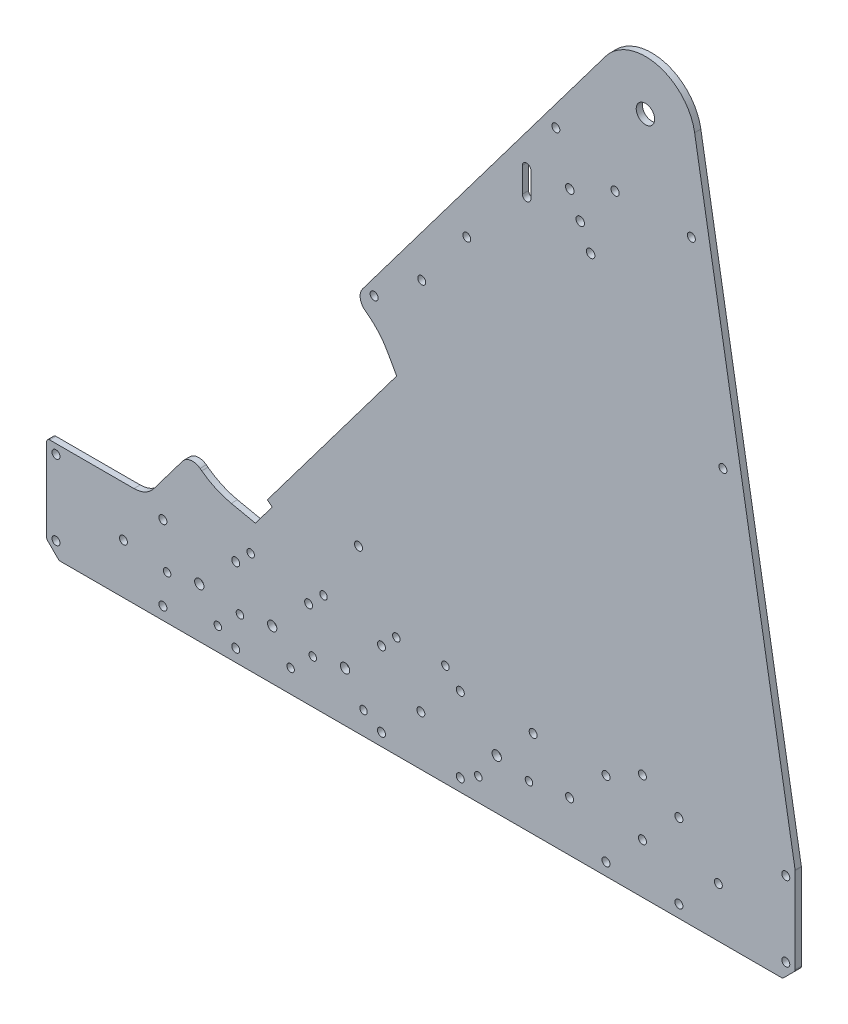
from build123d import *

# Parameters (mm, degrees)
BOSS_EXTRUDE1_DEPTH = 3.175
CUT_EXTRUDE1_REACH  = 534.132
SKETCH2_R           = 2.032
SKETCH5_R           = 2.032
SKETCH5_R_2         = 2.38125
CUT_EXTRUDE4_DEPTH  = 533.132273265
SKETCH6_R           = 2.032
CUT_EXTRUDE5_DEPTH  = 533.132273265
SKETCH3_R           = 4.699
SKETCH3_R_2         = 2.032
SKETCH3_R_3         = 2.0955
SKETCH3_R_4         = 2.159
CUT_EXTRUDE2_DEPTH  = 533.132273265
FILLET1_R           = 1.5875
CUT_EXTRUDE3_REACH  = 534.132
SKETCH4_R           = 1.905
FILLET2_R           = 38.1
FILLET3_R           = 6.35


with BuildPart() as part:
    # Sketch1 → Boss-Extrude1 (new body)
    with BuildSketch(Plane.XY):
        with BuildLine():
            Line((0, 0), (381, 0))
            Line((381, 0), (381, 50.8))
            Line((381, 50.8), (329.837432577, 350.351326687))
            ThreePointArc((329.837432577, 350.351326687), (310.787920632, 370.759100277), (284.504927721, 361.348180455))
            Line((284.504927721, 361.348180455), (157.027492501, 191.955579526))
            Line((157.027492501, 191.955579526), (169.711912675, 182.409841741))
            Line((169.711912675, 182.409841741), (178.167615548, 167.244965001))
            Line((178.167615548, 167.244965001), (112.326505112, 79.754995301))
            Line((112.326505112, 79.754995301), (114.863389147, 77.845847744))
            Line((114.863389147, 77.845847744), (106.272225141, 66.429869588))
            Line((106.272225141, 66.429869588), (85.709420174, 70.786944209))
            Line((85.709420174, 70.786944209), (73.025, 80.332681993))
            Line((73.025, 80.332681993), (54.610499914, 55.863409773))
            ThreePointArc((54.610499914, 55.863409773), (50.133294634, 52.136138511), (44.462963775, 50.8))
            Line((44.462963775, 50.8), (0, 50.8))
            Line((0, 50.8), (0, 0))
        make_face()
    extrude(amount=BOSS_EXTRUDE1_DEPTH)

    # Sketch2 → Cut-Extrude1 (cut, up to next)
    with BuildSketch(Plane.XY.offset(3.175), mode=Mode.PRIVATE) as cut_extrude1_sk1:
        with Locations((4.7625, 46.0375)):
            Circle(SKETCH2_R)
    cut_extrude1_tool1 = extrude(cut_extrude1_sk1.sketch, amount=-CUT_EXTRUDE1_REACH, mode=Mode.PRIVATE) & part.part
    # Sketch2 → Cut-Extrude1 (cut, up to next)
    with BuildSketch(Plane.XY.offset(3.175), mode=Mode.PRIVATE) as cut_extrude1_sk2:
        with Locations((4.7625, 7.9375)):
            Circle(SKETCH2_R)
    cut_extrude1_tool2 = extrude(cut_extrude1_sk2.sketch, amount=-CUT_EXTRUDE1_REACH, mode=Mode.PRIVATE) & part.part
    # Sketch2 → Cut-Extrude1 (cut, up to next)
    with BuildSketch(Plane.XY.offset(3.175), mode=Mode.PRIVATE) as cut_extrude1_sk3:
        with Locations((376.2375, 7.9375)):
            Circle(SKETCH2_R)
    cut_extrude1_tool3 = extrude(cut_extrude1_sk3.sketch, amount=-CUT_EXTRUDE1_REACH, mode=Mode.PRIVATE) & part.part
    # Sketch2 → Cut-Extrude1 (cut, up to next)
    with BuildSketch(Plane.XY.offset(3.175), mode=Mode.PRIVATE) as cut_extrude1_sk4:
        with Locations((376.2375, 46.0375)):
            Circle(SKETCH2_R)
    cut_extrude1_tool4 = extrude(cut_extrude1_sk4.sketch, amount=-CUT_EXTRUDE1_REACH, mode=Mode.PRIVATE) & part.part
    # Sketch2 → Cut-Extrude1 (cut, up to next)
    with BuildSketch(Plane.XY.offset(3.175), mode=Mode.PRIVATE) as cut_extrude1_sk5:
        Polygon((0, 6.35), (0, 0), (6.35, 0), align=None)
    cut_extrude1_tool5 = extrude(cut_extrude1_sk5.sketch, amount=-CUT_EXTRUDE1_REACH, mode=Mode.PRIVATE) & part.part
    # Sketch2 → Cut-Extrude1 (cut, up to next)
    with BuildSketch(Plane.XY.offset(3.175), mode=Mode.PRIVATE) as cut_extrude1_sk6:
        Polygon((381, 0), (374.65, 0), (381, 6.35), align=None)
    cut_extrude1_tool6 = extrude(cut_extrude1_sk6.sketch, amount=-CUT_EXTRUDE1_REACH, mode=Mode.PRIVATE) & part.part
    add(cut_extrude1_tool1.solids().sort_by_distance((4.7625, 46.0375, 3.175))[0], mode=Mode.SUBTRACT)
    add(cut_extrude1_tool2.solids().sort_by_distance((4.7625, 7.9375, 3.175))[0], mode=Mode.SUBTRACT)
    add(cut_extrude1_tool3.solids().sort_by_distance((376.2375, 7.9375, 3.175))[0], mode=Mode.SUBTRACT)
    add(cut_extrude1_tool4.solids().sort_by_distance((376.2375, 46.0375, 3.175))[0], mode=Mode.SUBTRACT)
    add(cut_extrude1_tool5.solids().sort_by_distance((2.116667, 2.116667, 3.175))[0], mode=Mode.SUBTRACT)
    add(cut_extrude1_tool6.solids().sort_by_distance((378.883333, 2.116667, 3.175))[0], mode=Mode.SUBTRACT)

    # Sketch5 → Cut-Extrude4 (cut, through all)
    with BuildSketch(Plane.XY.offset(3.175)):
        with Locations((39.116, 25.4)):
            Circle(SKETCH5_R)
        with Locations((59.182, 6.35)):
            Circle(SKETCH5_R)
        with Locations((59.182, 44.45)):
            Circle(SKETCH5_R)
        with Locations((96.266, 44.45)):
            Circle(SKETCH5_R)
        with Locations((133.35, 44.45)):
            Circle(SKETCH5_R)
        with Locations((170.434, 44.45)):
            Circle(SKETCH5_R)
        with Locations((210.566, 44.45)):
            Circle(SKETCH5_R)
        with Locations((210.566, 6.35)):
            Circle(SKETCH5_R)
        with Locations((170.434, 6.35)):
            Circle(SKETCH5_R)
        with Locations((247.65, 44.45)):
            Circle(SKETCH5_R)
        with Locations((266.192, 25.4)):
            Circle(SKETCH5_R)
        with Locations((77.724, 25.4)):
            Circle(SKETCH5_R_2)
        with Locations((114.808, 25.4)):
            Circle(SKETCH5_R_2)
        with Locations((151.892, 25.4)):
            Circle(SKETCH5_R_2)
        with Locations((229.108, 25.4)):
            Circle(SKETCH5_R_2)
        with Locations((190.5, 25.4)):
            Circle(SKETCH5_R)
        with Locations((303.276, 25.4)):
            Circle(SKETCH5_R)
        with Locations((341.884, 25.4)):
            Circle(SKETCH5_R)
    extrude(amount=-CUT_EXTRUDE4_DEPTH, mode=Mode.SUBTRACT)

    # Sketch6 → Cut-Extrude5 (cut, through all)
    with BuildSketch(Plane.XY.offset(3.175)):
        with Locations((284.734, 44.45)):
            Circle(SKETCH6_R)
        with Locations((284.734, 6.35)):
            Circle(SKETCH6_R)
        with Locations((321.818, 6.35)):
            Circle(SKETCH6_R)
        with Locations((321.818, 44.45)):
            Circle(SKETCH6_R)
        with Locations((96.266, 6.35)):
            Circle(SKETCH6_R)
        with Locations((303.276, 53.975)):
            Circle(SKETCH6_R)
    extrude(amount=-CUT_EXTRUDE5_DEPTH, mode=Mode.SUBTRACT)

    # Sketch3 → Cut-Extrude2 (cut, through all)
    with BuildSketch(Plane.XY.offset(3.175)):
        with Locations((304.8, 346.075)):
            Circle(SKETCH3_R)
        with Locations((166.6875, 196.85)):
            Circle(SKETCH3_R_2)
        with Locations((158.75, 82.55)):
            Circle(SKETCH3_R_2)
        with Locations((289.373209699, 304.387871998)):
            Circle(SKETCH3_R_3)
        with Locations((266.295701738, 293.777093219)):
            Circle(SKETCH3_R_4)
        with Locations((271.601091128, 282.238339238)):
            Circle(SKETCH3_R_4)
        with Locations((276.906480518, 270.699585258)):
            Circle(SKETCH3_R_4)
        with Locations((328.186766793, 303.440372165)):
            Circle(SKETCH3_R_2)
        with Locations((344.222991868, 209.55)):
            Circle(SKETCH3_R_2)
        with Locations((259.211844923, 317.178274551)):
            Circle(SKETCH3_R_2)
        with Locations((213.851281588, 246.342608418)):
            Circle(SKETCH3_R_2)
        with Locations((190.941510906, 215.9)):
            Circle(SKETCH3_R_2)
        with BuildLine():
            Line((242.153661094, 279.4), (242.153661094, 292.1))
            ThreePointArc((242.153661094, 292.1), (244.312661094, 294.259), (246.471661094, 292.1))
            Line((246.471661094, 292.1), (246.471661094, 279.4))
            ThreePointArc((246.471661094, 279.4), (244.312661094, 277.241), (242.153661094, 279.4))
        make_face()
    extrude(amount=-CUT_EXTRUDE2_DEPTH, mode=Mode.SUBTRACT)

    # Fillet1
    fillet1_edges = [part.edges().sort_by_distance(p)[0] for p in [
        (374.65, 0, 1.5875),
        (381, 6.35, 1.5875),
        (381, 50.8, 1.5875),
        (6.35, 0, 1.5875),
        (0, 6.35, 1.5875),
        (0, 50.8, 1.5875),
    ]]
    fillet(fillet1_edges, radius=FILLET1_R)

    # Sketch4 → Cut-Extrude3 (cut, up to next)
    with BuildSketch(Plane(origin=(0, 0, 0), x_dir=(-1, 0, 0), z_dir=(0, 0, -1)), mode=Mode.PRIVATE) as cut_extrude3_sk1:
        with Locations((-61.318145625, 22.298133105)):
            Circle(SKETCH4_R)
    cut_extrude3_tool1 = extrude(cut_extrude3_sk1.sketch, amount=-CUT_EXTRUDE3_REACH, mode=Mode.PRIVATE) & part.part
    # Sketch4 → Cut-Extrude3 (cut, up to next)
    with BuildSketch(Plane(origin=(0, 0, 0), x_dir=(-1, 0, 0), z_dir=(0, 0, -1)), mode=Mode.PRIVATE) as cut_extrude3_sk2:
        with Locations((-87.131339764, 11.605958005)):
            Circle(SKETCH4_R)
    cut_extrude3_tool2 = extrude(cut_extrude3_sk2.sketch, amount=-CUT_EXTRUDE3_REACH, mode=Mode.PRIVATE) & part.part
    # Sketch4 → Cut-Extrude3 (cut, up to next)
    with BuildSketch(Plane(origin=(0, 0, 0), x_dir=(-1, 0, 0), z_dir=(0, 0, -1)), mode=Mode.PRIVATE) as cut_extrude3_sk3:
        with Locations((-98.402145625, 22.298133105)):
            Circle(SKETCH4_R)
    cut_extrude3_tool3 = extrude(cut_extrude3_sk3.sketch, amount=-CUT_EXTRUDE3_REACH, mode=Mode.PRIVATE) & part.part
    # Sketch4 → Cut-Extrude3 (cut, up to next)
    with BuildSketch(Plane(origin=(0, 0, 0), x_dir=(-1, 0, 0), z_dir=(0, 0, -1)), mode=Mode.PRIVATE) as cut_extrude3_sk4:
        with Locations((-124.215339764, 11.605958005)):
            Circle(SKETCH4_R)
    cut_extrude3_tool4 = extrude(cut_extrude3_sk4.sketch, amount=-CUT_EXTRUDE3_REACH, mode=Mode.PRIVATE) & part.part
    # Sketch4 → Cut-Extrude3 (cut, up to next)
    with BuildSketch(Plane(origin=(0, 0, 0), x_dir=(-1, 0, 0), z_dir=(0, 0, -1)), mode=Mode.PRIVATE) as cut_extrude3_sk5:
        with Locations((-135.486145625, 22.298133105)):
            Circle(SKETCH4_R)
    cut_extrude3_tool5 = extrude(cut_extrude3_sk5.sketch, amount=-CUT_EXTRUDE3_REACH, mode=Mode.PRIVATE) & part.part
    # Sketch4 → Cut-Extrude3 (cut, up to next)
    with BuildSketch(Plane(origin=(0, 0, 0), x_dir=(-1, 0, 0), z_dir=(0, 0, -1)), mode=Mode.PRIVATE) as cut_extrude3_sk6:
        with Locations((-161.299339764, 11.605958005)):
            Circle(SKETCH4_R)
    cut_extrude3_tool6 = extrude(cut_extrude3_sk6.sketch, amount=-CUT_EXTRUDE3_REACH, mode=Mode.PRIVATE) & part.part
    # Sketch4 → Cut-Extrude3 (cut, up to next)
    with BuildSketch(Plane(origin=(0, 0, 0), x_dir=(-1, 0, 0), z_dir=(0, 0, -1)), mode=Mode.PRIVATE) as cut_extrude3_sk7:
        with Locations((-245.513854375, 22.298133105)):
            Circle(SKETCH4_R)
    cut_extrude3_tool7 = extrude(cut_extrude3_sk7.sketch, amount=-CUT_EXTRUDE3_REACH, mode=Mode.PRIVATE) & part.part
    # Sketch4 → Cut-Extrude3 (cut, up to next)
    with BuildSketch(Plane(origin=(0, 0, 0), x_dir=(-1, 0, 0), z_dir=(0, 0, -1)), mode=Mode.PRIVATE) as cut_extrude3_sk8:
        with Locations((-219.700660236, 11.605958005)):
            Circle(SKETCH4_R)
    cut_extrude3_tool8 = extrude(cut_extrude3_sk8.sketch, amount=-CUT_EXTRUDE3_REACH, mode=Mode.PRIVATE) & part.part
    # Sketch4 → Cut-Extrude3 (cut, up to next)
    with BuildSketch(Plane(origin=(0, 0, 0), x_dir=(-1, 0, 0), z_dir=(0, 0, -1)), mode=Mode.PRIVATE) as cut_extrude3_sk9:
        with Locations((-202.981986443, 51.968407021)):
            Circle(SKETCH4_R)
    cut_extrude3_tool9 = extrude(cut_extrude3_sk9.sketch, amount=-CUT_EXTRUDE3_REACH, mode=Mode.PRIVATE) & part.part
    # Sketch4 → Cut-Extrude3 (cut, up to next)
    with BuildSketch(Plane(origin=(0, 0, 0), x_dir=(-1, 0, 0), z_dir=(0, 0, -1)), mode=Mode.PRIVATE) as cut_extrude3_sk10:
        with Locations((-178.018013557, 51.968407021)):
            Circle(SKETCH4_R)
    cut_extrude3_tool10 = extrude(cut_extrude3_sk10.sketch, amount=-CUT_EXTRUDE3_REACH, mode=Mode.PRIVATE) & part.part
    # Sketch4 → Cut-Extrude3 (cut, up to next)
    with BuildSketch(Plane(origin=(0, 0, 0), x_dir=(-1, 0, 0), z_dir=(0, 0, -1)), mode=Mode.PRIVATE) as cut_extrude3_sk11:
        with Locations((-140.934013557, 51.968407021)):
            Circle(SKETCH4_R)
    cut_extrude3_tool11 = extrude(cut_extrude3_sk11.sketch, amount=-CUT_EXTRUDE3_REACH, mode=Mode.PRIVATE) & part.part
    # Sketch4 → Cut-Extrude3 (cut, up to next)
    with BuildSketch(Plane(origin=(0, 0, 0), x_dir=(-1, 0, 0), z_dir=(0, 0, -1)), mode=Mode.PRIVATE) as cut_extrude3_sk12:
        with Locations((-103.850013557, 51.968407021)):
            Circle(SKETCH4_R)
    cut_extrude3_tool12 = extrude(cut_extrude3_sk12.sketch, amount=-CUT_EXTRUDE3_REACH, mode=Mode.PRIVATE) & part.part
    add(cut_extrude3_tool1.solids().sort_by_distance((61.318146, 22.298133, 0))[0], mode=Mode.SUBTRACT)
    add(cut_extrude3_tool2.solids().sort_by_distance((87.13134, 11.605958, 0))[0], mode=Mode.SUBTRACT)
    add(cut_extrude3_tool3.solids().sort_by_distance((98.402146, 22.298133, 0))[0], mode=Mode.SUBTRACT)
    add(cut_extrude3_tool4.solids().sort_by_distance((124.21534, 11.605958, 0))[0], mode=Mode.SUBTRACT)
    add(cut_extrude3_tool5.solids().sort_by_distance((135.486146, 22.298133, 0))[0], mode=Mode.SUBTRACT)
    add(cut_extrude3_tool6.solids().sort_by_distance((161.29934, 11.605958, 0))[0], mode=Mode.SUBTRACT)
    add(cut_extrude3_tool7.solids().sort_by_distance((245.513854, 22.298133, 0))[0], mode=Mode.SUBTRACT)
    add(cut_extrude3_tool8.solids().sort_by_distance((219.70066, 11.605958, 0))[0], mode=Mode.SUBTRACT)
    add(cut_extrude3_tool9.solids().sort_by_distance((202.981986, 51.968407, 0))[0], mode=Mode.SUBTRACT)
    add(cut_extrude3_tool10.solids().sort_by_distance((178.018014, 51.968407, 0))[0], mode=Mode.SUBTRACT)
    add(cut_extrude3_tool11.solids().sort_by_distance((140.934014, 51.968407, 0))[0], mode=Mode.SUBTRACT)
    add(cut_extrude3_tool12.solids().sort_by_distance((103.850014, 51.968407, 0))[0], mode=Mode.SUBTRACT)

    # Fillet2
    fillet2_edges = [part.edges().sort_by_distance(p)[0] for p in [
        (85.709420174, 70.786944209, 1.5875),
        (169.711912675, 182.409841741, 1.5875),
    ]]
    fillet(fillet2_edges, radius=FILLET2_R)

    # Fillet3
    fillet3_edges = [part.edges().sort_by_distance(p)[0] for p in [
        (73.025, 80.332681993, 1.5875),
        (157.027492501, 191.955579526, 1.5875),
    ]]
    fillet(fillet3_edges, radius=FILLET3_R)


solid = part.part
